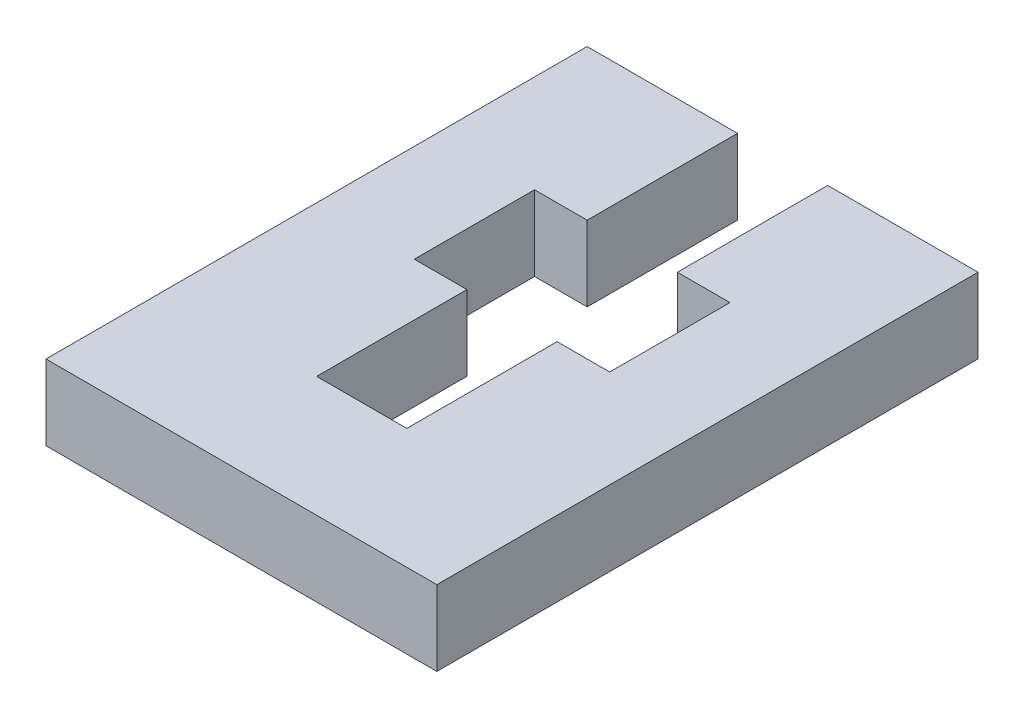
from build123d import *

# Parameters (mm, degrees)
BOSS_EXTRUDE1_DEPTH = 2.5


with BuildPart() as part:
    # Sketch1 → Boss-Extrude1 (new body)
    with BuildSketch(Plane(origin=(0, 0, 0), x_dir=(1, 0, 0), z_dir=(0, 1, 0))):
        Polygon((1.5, 8.5), (1.5, 3.5), (3.25, 3.5), (3.25, -0.5), (1.5, -0.5), (1.5, -5.5), (-1.5, -5.5), (-1.5, -0.5), (-3.25, -0.5), (-3.25, 3.5), (-1.5, 3.5), (-1.5, 8.5), (-6.5, 8.5), (-6.5, -9.5), (6.5, -9.5), (6.5, 8.5), align=None)
    extrude(amount=BOSS_EXTRUDE1_DEPTH)


solid = part.part
